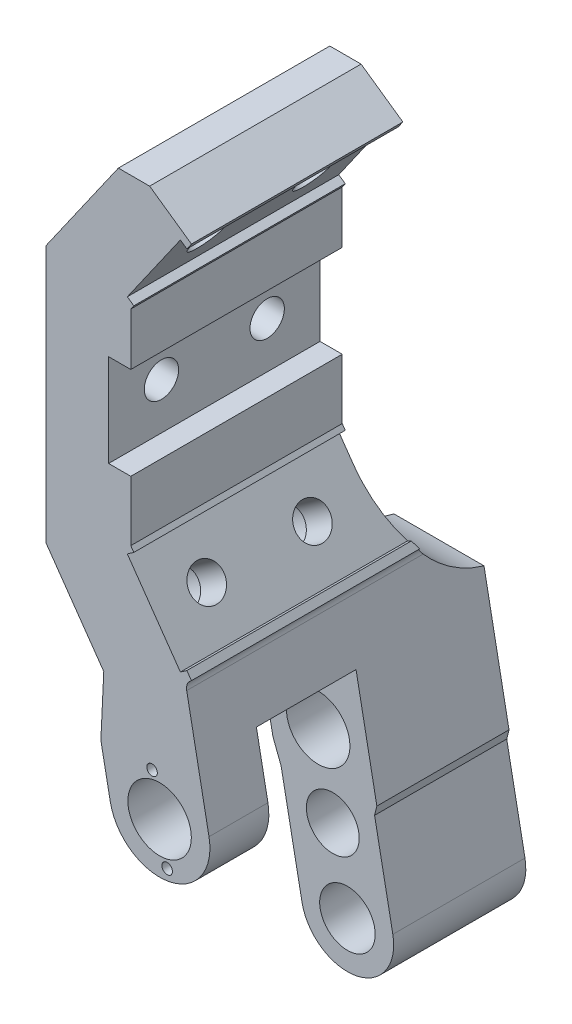
from build123d import *

# Parameters (mm, degrees)
SKETCH_1_R                = 12.000000000000052
EXTRUDE_1_DEPTH           = 110
SKETCH_79_R               = 10.500000000000002
CUT_EXTRUDE_45_DEPTH      = 119.99999999999999
EXTRUDE_2_DEPTH           = 110
CUT_EXTRUDE_46_DEPTH      = 89
CUT_EXTRUDE_46_DEPTH_BACK = 89
CUT_EXTRUDE_48_DEPTH      = 239.00000000000009
CUT_EXTRUDE_49_DEPTH      = 239.00000000000009
SKETCH_93_R               = 6.500000000000002
SKETCH_93_R_2             = 6.500000000000001
CUT_EXTRUDE_50_DEPTH      = 239.00000000000009
SKETCH_94_R               = 9.499999999999995
SKETCH_94_R_2             = 9.500000000000002
CUT_EXTRUDE_51_DEPTH      = 20
SKETCH_95_R               = 6.500000000000003
CUT_EXTRUDE_52_DEPTH      = 62.00000000000001
SKETCH_96_R               = 9.50000000000001
CUT_EXTRUDE_53_DEPTH      = 26
SKETCH_97_R               = 6.500000000000003
CUT_EXTRUDE_54_DEPTH      = 52.00000000000001
CUT_EXTRUDE_56_DEPTH      = 30
CHAMFER_1_SIZE            = 15
CHAMFER_1_SIZE2           = 6.994614872324999
CHAMFER_2_SIZE            = 17
CHAMFER_2_SIZE2           = 2.99755867204391
CUT_EXTRUDE_57_DEPTH      = 99.99999999999999
CUT_EXTRUDE_61_DEPTH      = 311.8166526922088
CUT_EXTRUDE_62_DEPTH      = 50
FILLET_3_R                = 19
EXTRUDE_3_DEPTH           = 50
SKETCH_107_R              = 2.0000000000000036
SKETCH_107_R_2            = 2.0000000000000027
CUT_EXTRUDE_63_DEPTH      = 15
EXTRUDE_4_DEPTH           = 80
SKETCH_109_R              = 6.500000000000003
CUT_EXTRUDE_64_DEPTH      = 80
SKETCH_110_R              = 9.5
SKETCH_110_R_2            = 9.499999999999993
CUT_EXTRUDE_65_DEPTH      = 18
FILLET_5_R                = 40
CUT_EXTRUDE_66_DEPTH      = 313.378967275511
CUT_EXTRUDE_67_DEPTH      = 313.378967275511
SKETCH_113_R              = 10.000000000000004
CUT_EXTRUDE_68_DEPTH      = 313.378967275511
CUT_EXTRUDE_69_DEPTH      = 304.118160452512
CUT_EXTRUDE_70_DEPTH      = 313.378967275511
FILLET_6_R                = 4


with BuildPart() as part:
    # 草图1 → 拉伸1 (new body)
    with BuildSketch(Plane.XY):
        with BuildLine():
            Line((-28.976730988546294, -151.6118545806237), (-4.886520661802549, -186.0162404407615))
            Line((-4.886520661802549, -186.0162404407615), (12.286288922085955, -274.3626869510514))
            ThreePointArc((12.286288922085955, -274.3626869510514), (31.04526778327322, -287.0157779601894), (43.69835879241124, -268.25679909900214))
            Line((43.69835879241124, -268.25679909900214), (21.02326901145373, -151.6035749038858))
            Line((21.02326901145373, -151.6035749038858), (6.0232690114537295, -130.18135480275456))
            Line((6.0232690114537295, -130.18135480275456), (6.023269011453701, -52.647312191388025))
            Line((6.023269011453701, -52.647312191388025), (28.96632646549536, -19.88123041982822))
            Line((28.96632646549536, -19.88123041982822), (0.2960049153805317, 0.19394485245823218))
            Line((0.2960049153805317, 0.19394485245823218), (-28.976730988546297, -41.61185458062371))
            Line((-28.976730988546297, -41.61185458062371), (-28.976730988546294, -151.6118545806237))
        make_face()
        with Locations((16.925402125409377, -214.37536638506216)):
            Circle(SKETCH_1_R, mode=Mode.SUBTRACT)
    extrude(amount=EXTRUDE_1_DEPTH)

    # 草图79 → 切除-拉伸45 (cut)
    with BuildSketch(Plane.XY.offset(110)):
        with Locations((27.992323857248596, -271.30974302502676)):
            Circle(SKETCH_79_R)
    extrude(amount=-CUT_EXTRUDE_45_DEPTH, mode=Mode.SUBTRACT)

    # 草图84 → 拉伸2 (add)
    with BuildSketch(Plane.XY.offset(110)):
        Polygon((33.778866566137545, -180.53953408076273), (44.27305222911856, -234.52743907759367), (37.4016619449849, -235.8631020452294), (21.02326901145373, -151.6035749038858), (30.894607438439245, -165.70130720226237), align=None)
        Polygon((5.989592074660172, -241.96898989727845), (3.0447105243171766, -242.54141688340806), (-9.117094273367561, -179.974355170029), (-4.886520661802549, -186.0162404407615), (-4.1690194468529445, -189.7074641975933), align=None)
    extrude(amount=-EXTRUDE_2_DEPTH)

    # 草图87 → 切除-拉伸46 (cut, two sides: drawn at the far end of the back side and taken through both)
    with BuildSketch(Plane(origin=(-8.137997067664443, -1.5818663857744057, 0), x_dir=(0, 0, -1), z_dir=(0.9816271834476652, 0.1908089953765384, 0)).offset(-CUT_EXTRUDE_46_DEPTH_BACK)):
        Polygon((-87.7, -287.6662060810232), (-87.7, -190.66620608102318), (-49.99999999999997, -190.66620608102318), (-49.999999999999964, -287.6662060810232), align=None)
    extrude(amount=CUT_EXTRUDE_46_DEPTH + CUT_EXTRUDE_46_DEPTH_BACK, mode=Mode.SUBTRACT)

    # 草图91 → 切除-拉伸48 (cut)
    with BuildSketch(Plane(origin=(0, 0, 0), x_dir=(-1, 0, 0), z_dir=(0, 0, -1))):
        Polygon((-27.245597156442233, -22.338686552695204), (-24.78814102357525, -20.61795724364208), (-4.712965751288797, -49.288278793756916), (-7.17042188415578, -51.00900810281004), align=None)
        Polygon((-7.1704218841557825, -131.81965889133255), (-27.24559715644222, -160.48998044144736), (-24.788141023575246, -162.21070975050048), (-4.712965751288817, -133.54038820038565), align=None)
    extrude(amount=-CUT_EXTRUDE_48_DEPTH, mode=Mode.SUBTRACT)

    # 草图92 → 切除-拉伸49 (cut)
    with BuildSketch(Plane.XY.offset(110)):
        Polygon((6.0232690114537295, -72.45119809723869), (-2.3767309885462713, -72.45119809723869), (-2.3767309885462713, -107.45119809723869), (6.023269011453735, -107.45119809723869), align=None)
    extrude(amount=-CUT_EXTRUDE_49_DEPTH, mode=Mode.SUBTRACT)

    # 草图93 → 切除-拉伸50 (cut)
    with BuildSketch(Plane(origin=(26.320363423382695, -18.42971687747145, 0), x_dir=(0, 0, -1), z_dir=(0.819152044288995, -0.5735764363510417, 0))):
        with Locations(Location((-90, -20.171348233123165, 0), (0, 0, 90))):
            Circle(SKETCH_93_R)
        with Locations(Location((-49.99999999999999, -20.171348233123165, 0), (0, 0, 90))):
            Circle(SKETCH_93_R_2)
    extrude(amount=-CUT_EXTRUDE_50_DEPTH, mode=Mode.SUBTRACT)

    # 草图94 → 切除-拉伸51 (cut)
    with BuildSketch(Plane(origin=(0.1074980061348375, -0.07527091423812592, 0), x_dir=(0, 0, 1), z_dir=(-0.819152044288995, 0.5735764363510416, 0))):
        with Locations(Location((90, -20.171348233123137, 0), (0, 0, 270))):
            Circle(SKETCH_94_R)
        with Locations(Location((49.99999999999999, -20.171348233123467, 0), (0, 0, 270))):
            Circle(SKETCH_94_R_2)
    extrude(amount=-CUT_EXTRUDE_51_DEPTH, mode=Mode.SUBTRACT)

    # 草图95 → 切除-拉伸52 (cut)
    with BuildSketch(Plane(origin=(-59.581011197876926, -41.71907317491002, 0), x_dir=(0, 0, -1), z_dir=(0.8191520442889946, 0.5735764363510422, 0))):
        with Locations(Location((-90, -129.59312808976065, 0), (0, 0, 90))):
            Circle(SKETCH_95_R)
        with Locations(Location((-49.99999999999999, -129.59312808976065, 0), (0, 0, 90))):
            Circle(SKETCH_95_R)
    extrude(amount=-CUT_EXTRUDE_52_DEPTH, mode=Mode.SUBTRACT)

    # 草图96 → 切除-拉伸53 (cut)
    with BuildSketch(Plane(origin=(-90.67794882371814, -63.493383315761, 0), x_dir=(0, 0, 1), z_dir=(-0.819152044288995, -0.5735764363510415, 0))):
        with Locations(Location((90, -129.59312808976048, 0), (0, 0, 270))):
            Circle(SKETCH_96_R)
        with Locations(Location((49.99999999999999, -129.59312808976048, 0), (0, 0, 270))):
            Circle(SKETCH_96_R)
    extrude(amount=-CUT_EXTRUDE_53_DEPTH, mode=Mode.SUBTRACT)

    # 草图97 → 切除-拉伸54 (cut)
    with BuildSketch(Plane(origin=(-2.3767309885462713, 0, 0), x_dir=(0, 0, -1), z_dir=(1, 0, 0))):
        with Locations((-90, -89.95119809723869)):
            Circle(SKETCH_97_R)
        with Locations((-49.99999999999999, -89.95119809723869)):
            Circle(SKETCH_97_R)
    extrude(amount=-CUT_EXTRUDE_54_DEPTH, mode=Mode.SUBTRACT)

    # 草图99 → 切除-拉伸56 (cut)
    with BuildSketch(Plane.XY.offset(110)):
        Polygon((2.8366871656253227, -242.58185252817833), (50.557361432229264, -233.30589311197602), (61.540376104596135, -289.8086053521652), (8.071539904446078, -294.7746451108994), align=None)
    extrude(amount=-CUT_EXTRUDE_56_DEPTH, mode=Mode.SUBTRACT)

    # 倒角1
    chamfer_1_edges = [part.edges().sort_by_distance(p)[0] for p in [
        (44.27305222911856, -234.52743907759367, 24.999999999999986),
    ]]
    chamfer_1_side = [part.faces().sort_by_distance(p)[0] for p in [
        (44.02415054875298, -233.24695093828703, 98.85),
    ]]
    chamfer(chamfer_1_edges, length=CHAMFER_1_SIZE, length2=CHAMFER_1_SIZE2, reference=chamfer_1_side[0])

    # 倒角2
    chamfer_2_edges = [part.edges().sort_by_distance(p)[0] for p in [
        (3.0447105243171766, -242.54141688340806, 24.999999999999986),
    ]]
    chamfer_2_side = [part.faces().sort_by_distance(p)[0] for p in [
        (-3.0361918745251923, -211.25788602671855, 108.72867994952558),
    ]]
    chamfer(chamfer_2_edges, length=CHAMFER_2_SIZE, length2=CHAMFER_2_SIZE2, reference=chamfer_2_side[0])

    # 草图100 → 切除-拉伸57 (cut)
    with BuildSketch(Plane.ZY.offset(28.976730988546297)):
        Polygon((0, 0.19394485245823218), (30, 0.19394485245823218), (30.00000000000002, -179.974355170029), (0, -179.974355170029), align=None)
    extrude(amount=-CUT_EXTRUDE_57_DEPTH, mode=Mode.SUBTRACT)

    # 草图103 → 切除-拉伸61 (cut, through all)
    with BuildSketch(Plane.XY.offset(110)):
        Polygon((44.27305222911856, -234.52743907759367), (40.34654349532844, -235.2906750590997), (32.288610890773896, -193.56151895418722), (28.966326465495865, -162.94743657431397), (30.894607438439245, -165.70130720226237), align=None)
    extrude(amount=-CUT_EXTRUDE_61_DEPTH, mode=Mode.SUBTRACT)

    # 草图104 → 切除-拉伸62 (cut)
    with BuildSketch(Plane.XY.offset(110)):
        Polygon((20.55077303756356, -233.02628287056783), (39.20895300997954, -229.3995000795826), (40.34654349532844, -235.2906750590997), (3.0447105243171766, -242.54141688340806), (1.899856552057948, -236.65165378272198), align=None)
    extrude(amount=-CUT_EXTRUDE_62_DEPTH, mode=Mode.SUBTRACT)

    # 圆角3
    fillet_3_edges = [part.edges().sort_by_distance(p)[0] for p in [
        (39.20895300997954, -229.3995000795826, 98.85),
        (1.899856552057948, -236.65165378272198, 98.85),
    ]]
    fillet(fillet_3_edges, radius=FILLET_3_R)

    # 草图105 → 拉伸3 (add)
    with BuildSketch(Plane(origin=(0, 0, 0), x_dir=(-1, 0, 0), z_dir=(0, 0, -1))):
        with BuildLine():
            Line((-5.989592074660172, -241.96898989727845), (-12.286288922085959, -274.36268695105144))
            ThreePointArc((-12.286288922085959, -274.36268695105144), (-31.045267783273285, -287.0157779601894), (-43.69835879241124, -268.2567990990021))
            Line((-43.69835879241124, -268.2567990990021), (-37.401661944984895, -235.86310204522937))
            Line((-37.401661944984895, -235.86310204522937), (-38.26160282801645, -232.42584977227457))
            Line((-38.26160282801645, -232.42584977227457), (-38.87410272015639, -235.57688855216452))
            Line((-38.87410272015639, -235.57688855216452), (-45.17079956758273, -267.9705856059373))
            ThreePointArc((-45.17079956758273, -267.9705856059373), (-31.33148127633808, -288.4882187353609), (-10.813848146914461, -274.64890044411624))
            Line((-10.813848146914461, -274.64890044411624), (-4.517151299488675, -242.25520339034327))
            Line((-4.517151299488675, -242.25520339034327), (-2.8953187153952267, -233.91159805661354))
            Line((-2.8953187153952267, -233.91159805661354), (-5.989592074660172, -241.96898989727845))
        make_face()
    extrude(amount=-EXTRUDE_3_DEPTH)

    # 草图107 → 切除-拉伸63 (cut)
    with BuildSketch(Plane.XY.offset(110)):
        with Locations((19.787537056057417, -229.09977413677714)):
            Circle(SKETCH_107_R)
        with Locations(Location((14.063267194761325, -199.65095863334716, 0), (0, 0, 180))):
            Circle(SKETCH_107_R_2)
    extrude(amount=-CUT_EXTRUDE_63_DEPTH, mode=Mode.SUBTRACT)

    # 草图108 → 拉伸4 (add)
    with BuildSketch(Plane(origin=(0, 3.47e-15, 30), x_dir=(-1, 0, 0), z_dir=(0, -1.2e-16, -1))):
        Polygon((28.976730988546297, -41.6118545806237), (31.976730988546283, -45.896298600850045), (31.976730988546283, -147.32741056039734), (28.97673098854629, -151.6118545806237), align=None)
    extrude(amount=-EXTRUDE_4_DEPTH)

    # 草图109 → 切除-拉伸64 (cut)
    with BuildSketch(Plane(origin=(-2.3767309885462713, 0, 0), x_dir=(0, 0, -1), z_dir=(1, 0, 0))):
        with Locations((-90, -89.95119809723869)):
            Circle(SKETCH_109_R)
        with Locations((-49.99999999999999, -89.95119809723869)):
            Circle(SKETCH_109_R)
    extrude(amount=-CUT_EXTRUDE_64_DEPTH, mode=Mode.SUBTRACT)

    # 草图110 → 切除-拉伸65 (cut)
    with BuildSketch(Plane.ZY.offset(31.976730988546283)):
        with Locations((49.99999999999999, -89.95119809723869)):
            Circle(SKETCH_110_R)
        with Locations((90, -89.95119809723869)):
            Circle(SKETCH_110_R_2)
    extrude(amount=-CUT_EXTRUDE_65_DEPTH, mode=Mode.SUBTRACT)

    # 圆角5
    # the kernel refuses this fillet: 40 mm, written as the material it adds along each edge
    with BuildSketch(Plane(origin=(-105.941677928553, -179.974355170029, 30.00000000000002), x_dir=(0, 0, -1), z_dir=(1, 3e-17, 0))) as fillet_5_piece_1_section:
        with BuildLine():
            CenterArc((40, 38.72983346207417), FILLET_5_R, 180, 75.52248781407013)
            Line((3.55e-15, 38.72983346207417), (-0.7999999999999972, 38.72983346207417))
            Line((-0.7999999999999972, 38.72983346207417), (-0.8000000000000007, 0))
            Line((-0.8000000000000007, 0), (0, -0.8000000000000114))
            ThreePointArc((0, -0.8000000000000114), (15.00000000000001, -0.8000000000000114), (29.80000000000002, -0.7745966692414754))
            Line((29.80000000000002, -0.7745966692414754), (30.00000000000002, 0))
        make_face()
    fillet_5_piece_1 = extrude(amount=233.58037384137717, mode=Mode.PRIVATE)
    fillet_5_piece_1 = split(fillet_5_piece_1, bisect_by=Plane(origin=(-12.519533294924203, -162.47032383758483, 26.16807715627391), z_dir=(-0.9816271834476658, -0.19080899537653587, 0)), keep=Keep.TOP, mode=Mode.PRIVATE)
    fillet_5_piece_1 = split(fillet_5_piece_1, bisect_by=Plane(origin=(-19.41668158240475, -165.26502008436105, 26.168077156273903), z_dir=(0.8191520442889951, 0.5735764363510417, 0)), keep=Keep.TOP, mode=Mode.PRIVATE)
    fillet_5_piece_1 = split(fillet_5_piece_1, bisect_by=Plane(origin=(-31.976730988546283, -163.25223744066852, 26.168077156273903), z_dir=(1, 0, 0)), keep=Keep.TOP, mode=Mode.PRIVATE)
    add(fillet_5_piece_1)
    with BuildSketch(Plane(origin=(-105.941677928553, -179.974355170029, 30.00000000000002), x_dir=(0, 0, -1), z_dir=(1, 3e-17, 0))) as fillet_5_piece_2_section:
        with BuildLine():
            CenterArc((40, 38.72983346207417), FILLET_5_R, 180, 75.52248781407013)
            Line((3.55e-15, 38.72983346207417), (-0.7999999999999972, 38.72983346207417))
            Line((-0.7999999999999972, 38.72983346207417), (-0.8000000000000007, 0))
            Line((-0.8000000000000007, 0), (0, -0.8000000000000114))
            ThreePointArc((0, -0.8000000000000114), (15.00000000000001, -0.8000000000000114), (29.80000000000002, -0.7745966692414754))
            Line((29.80000000000002, -0.7745966692414754), (30.00000000000002, 0))
        make_face()
    fillet_5_piece_2 = extrude(amount=233.58037384137717, mode=Mode.PRIVATE)
    fillet_5_piece_2 = split(fillet_5_piece_2, bisect_by=Plane(origin=(-11.082360156329408, -169.86393867938773, 24.326706543866806), z_dir=(0.9816271834476658, 0.19080899537653587, 0)), keep=Keep.TOP, mode=Mode.PRIVATE)
    fillet_5_piece_2 = split(fillet_5_piece_2, bisect_by=Plane(origin=(-11.613613613415133, -176.40895605074695, 24.326706543866813), z_dir=(0.8191520442889951, 0.5735764363510417, 0)), keep=Keep.TOP, mode=Mode.PRIVATE)
    fillet_5_piece_2 = split(fillet_5_piece_2, bisect_by=Plane(origin=(6.42628721668682, -175.06781820158835, 24.326706543866813), z_dir=(-0.5735764363510439, 0.8191520442889935, 0)), keep=Keep.TOP, mode=Mode.PRIVATE)
    fillet_5_piece_2 = split(fillet_5_piece_2, bisect_by=Plane(origin=(19.48332401242609, -154.63464590989605, 24.326706543866813), z_dir=(-0.8191520442889955, -0.5735764363510409, 0)), keep=Keep.TOP, mode=Mode.PRIVATE)
    add(fillet_5_piece_2)
    with BuildSketch(Plane(origin=(-105.941677928553, -179.974355170029, 30.00000000000002), x_dir=(0, 0, -1), z_dir=(1, 3e-17, 0))) as fillet_5_piece_3_section:
        with BuildLine():
            CenterArc((40, 38.72983346207417), FILLET_5_R, 180, 75.52248781407013)
            Line((3.55e-15, 38.72983346207417), (-0.7999999999999972, 38.72983346207417))
            Line((-0.7999999999999972, 38.72983346207417), (-0.8000000000000007, 0))
            Line((-0.8000000000000007, 0), (0, -0.8000000000000114))
            ThreePointArc((0, -0.8000000000000114), (15.00000000000001, -0.8000000000000114), (29.80000000000002, -0.7745966692414754))
            Line((29.80000000000002, -0.7745966692414754), (30.00000000000002, 0))
        make_face()
    fillet_5_piece_3 = extrude(amount=233.58037384137717, mode=Mode.PRIVATE)
    fillet_5_piece_3 = split(fillet_5_piece_3, bisect_by=Plane(origin=(-9.009356536559634, -180.5286177765958, 15.359793017612816), z_dir=(0.9816271834476658, 0.19080899537653587, 0)), keep=Keep.TOP, mode=Mode.PRIVATE)
    fillet_5_piece_3 = split(fillet_5_piece_3, bisect_by=Plane(origin=(-8.790580858051872, -180.44066465328672, 15.359793017612818), z_dir=(-0.8191520442889951, -0.5735764363510417, 0)), keep=Keep.TOP, mode=Mode.PRIVATE)
    add(fillet_5_piece_3)
    with BuildSketch(Plane(origin=(-105.941677928553, -179.974355170029, 30.00000000000002), x_dir=(0, 0, -1), z_dir=(1, 3e-17, 0))) as fillet_5_piece_4_section:
        with BuildLine():
            CenterArc((40, 38.72983346207417), FILLET_5_R, 180, 75.52248781407013)
            Line((3.55e-15, 38.72983346207417), (-0.7999999999999972, 38.72983346207417))
            Line((-0.7999999999999972, 38.72983346207417), (-0.8000000000000007, 0))
            Line((-0.8000000000000007, 0), (0, -0.8000000000000114))
            ThreePointArc((0, -0.8000000000000114), (15.00000000000001, -0.8000000000000114), (29.80000000000002, -0.7745966692414754))
            Line((29.80000000000002, -0.7745966692414754), (30.00000000000002, 0))
        make_face()
    fillet_5_piece_4 = extrude(amount=233.58037384137717, mode=Mode.PRIVATE)
    fillet_5_piece_4 = split(fillet_5_piece_4, bisect_by=Plane(origin=(30.21304795631305, -174.43568668746965, 19.796073146276427), z_dir=(-0.9941630536657426, -0.10788801011236512, 0)), keep=Keep.TOP, mode=Mode.PRIVATE)
    fillet_5_piece_4 = split(fillet_5_piece_4, bisect_by=Plane(origin=(13.747414080736915, -169.94150998319088, 19.796073146276424), z_dir=(0.5735764363510439, -0.8191520442889935, 0)), keep=Keep.TOP, mode=Mode.PRIVATE)
    fillet_5_piece_4 = split(fillet_5_piece_4, bisect_by=Plane(origin=(28.87558550635858, -168.04818544125663, 19.796073146276424), z_dir=(-0.8191520442889955, -0.5735764363510409, 0)), keep=Keep.TOP, mode=Mode.PRIVATE)
    add(fillet_5_piece_4)
    with BuildSketch(Plane(origin=(-105.941677928553, -179.974355170029, 30.00000000000002), x_dir=(0, 0, -1), z_dir=(1, 3e-17, 0))) as fillet_5_piece_5_section:
        with BuildLine():
            CenterArc((40, 38.72983346207417), FILLET_5_R, 180, 75.52248781407013)
            Line((3.55e-15, 38.72983346207417), (-0.7999999999999972, 38.72983346207417))
            Line((-0.7999999999999972, 38.72983346207417), (-0.8000000000000007, 0))
            Line((-0.8000000000000007, 0), (0, -0.8000000000000114))
            ThreePointArc((0, -0.8000000000000114), (15.00000000000001, -0.8000000000000114), (29.80000000000002, -0.7745966692414754))
            Line((29.80000000000002, -0.7745966692414754), (30.00000000000002, 0))
        make_face()
    fillet_5_piece_5 = extrude(amount=233.58037384137717, mode=Mode.PRIVATE)
    fillet_5_piece_5 = split(fillet_5_piece_5, bisect_by=Plane(origin=(29.09882687348008, -164.1683971803753, 26.693876526491778), z_dir=(-0.9941630536657426, -0.10788801011236512, 0)), keep=Keep.TOP, mode=Mode.PRIVATE)
    fillet_5_piece_5 = split(fillet_5_piece_5, bisect_by=Plane(origin=(29.196430855580385, -163.27605970035572, 26.69387652649177), z_dir=(-0.8191520442889858, -0.5735764363510547, 0)), keep=Keep.TOP, mode=Mode.PRIVATE)
    fillet_5_piece_5 = split(fillet_5_piece_5, bisect_by=Plane(origin=(25.755372249163997, -161.53344715515144, 26.69387652649177), z_dir=(0.5735764363510439, -0.8191520442889935, 0)), keep=Keep.TOP, mode=Mode.PRIVATE)
    fillet_5_piece_5 = split(fillet_5_piece_5, bisect_by=Plane(origin=(26.73897472271284, -164.9967890094092, 26.69387652649177), z_dir=(0.8191520442889955, 0.5735764363510409, 0)), keep=Keep.TOP, mode=Mode.PRIVATE)
    add(fillet_5_piece_5)

    # 草图111 → 切除-拉伸66 (cut, through all)
    with BuildSketch(Plane.XY.offset(110)):
        Polygon((5.2109171811145, -3.247513765648018), (-25.976730988546283, -47.788091334123926), (-25.976730988546283, -145.43561782712345), (-4.202182007633594, -176.5328965519228), (-9.117094273367561, -179.974355170029), (-31.976730988546283, -147.32741056039734), (-31.976730988546283, -45.89629860085004), (0.2960049153805317, 0.19394485245823218), align=None)
    extrude(amount=-CUT_EXTRUDE_66_DEPTH, mode=Mode.SUBTRACT)

    # 草图112 → 切除-拉伸67 (cut, through all)
    with BuildSketch(Plane.XY.offset(110)):
        Polygon((-4.202182007633594, -176.5328965519228), (-5.300914365836842, -199.60689883898235), (-9.117094273367561, -179.974355170029), align=None)
    extrude(amount=-CUT_EXTRUDE_67_DEPTH, mode=Mode.SUBTRACT)

    # 草图113 → 切除-拉伸68 (cut, through all)
    with BuildSketch(Plane(origin=(0, 0, 0), x_dir=(-1, 0, 0), z_dir=(0, 0, -1))):
        with Locations((-22.45886299132899, -242.84255470504445)):
            Circle(SKETCH_113_R)
    extrude(amount=-CUT_EXTRUDE_68_DEPTH, mode=Mode.SUBTRACT)

    # 草图114 → 切除-拉伸69 (cut, through all)
    with BuildSketch(Plane(origin=(0, 3.47e-15, 30), x_dir=(-1, 0, 0), z_dir=(0, -1.2e-16, -1))):
        Polygon((-27.992323857248415, -8.809743025026684), (8.806750738436506, -8.809743025026684), (3.633058001479367, 5.847577984943226), align=None)
    extrude(amount=-CUT_EXTRUDE_69_DEPTH, mode=Mode.SUBTRACT)

    # 草图115 → 切除-拉伸70 (cut, through all)
    with BuildSketch(Plane.XY.offset(110)):
        Polygon((32.288610890773896, -193.56151895418722), (26.685411611572967, -164.54455034904527), (28.966326465495865, -162.94743657431397), align=None)
    extrude(amount=-CUT_EXTRUDE_70_DEPTH, mode=Mode.SUBTRACT)

    # 圆角6
    fillet_6_edges = [part.edges().sort_by_distance(p)[0] for p in [
        (26.685411611572967, -164.54455034904527, 66.25660377603798),
    ]]
    fillet(fillet_6_edges, radius=FILLET_6_R)


solid = part.part
